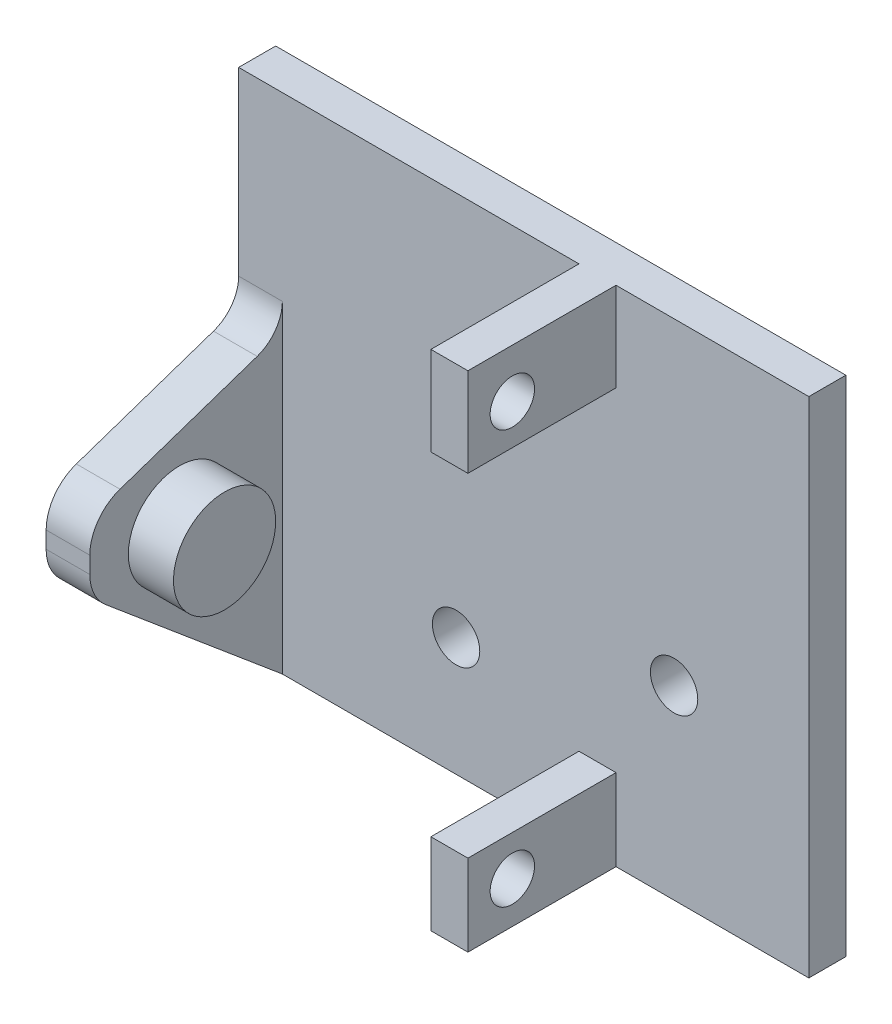
from build123d import *

# Parameters (mm, degrees)
ESBO_O1_W                = 38.5
ESBO_O1_H                = 34
RESSALTO_EXTRUS_O1_DEPTH = 2.5
ESBO_O2_W                = 2.5
ESBO_O2_H                = 6
ESBO_O2_H_2              = 5.5
RESSALTO_EXTRUS_O2_DEPTH = 10
CORTE_EXTRUS_O1_REACH    = 41.373
ESBO_O3_R                = 1.5
ESBO_O4_W                = 2.95
ESBO_O4_H                = 20
RESSALTO_EXTRUS_O3_DEPTH = 13
ESBO_O5_R                = 3.45
CORTE_EXTRUS_O2_DEPTH    = 15
FILETE1_R                = 3
FILETE2_R                = 2.5
ESBO_O7_R                = 3.45
RESSALTO_EXTRUS_O5_DEPTH = 6
ESBO_O8_R                = 1.6
CORTE_EXTRUS_O3_DEPTH    = 6


with BuildPart() as part:
    # Esboço1 → Ressalto-extrusão1 (new body)
    with BuildSketch(Plane.XY):
        with Locations((-3.395014232, -10.289862205)):
            Rectangle(ESBO_O1_W, ESBO_O1_H)
    extrude(amount=RESSALTO_EXTRUS_O1_DEPTH)

    # Esboço2 → Ressalto-extrusão2 (add)
    with BuildSketch(Plane.XY.offset(2.5)):
        with Locations((1.584985768, 3.710137795)):
            Rectangle(ESBO_O2_W, ESBO_O2_H)
        with Locations((1.584985768, -24.539862205)):
            Rectangle(ESBO_O2_W, ESBO_O2_H_2)
    extrude(amount=RESSALTO_EXTRUS_O2_DEPTH)

    # Esboço3 → Corte-extrusão1 (cut, up to next)
    with BuildSketch(Plane(origin=(2.834985768, 0, 0), x_dir=(0, 0, -1), z_dir=(1, 0, 0)), mode=Mode.PRIVATE) as corte_extrus_o1_sk1:
        with Locations(Location((-9.5, 3.410137795, 0), (0, 0, 90))):
            Circle(ESBO_O3_R)
    corte_extrus_o1_tool1 = extrude(corte_extrus_o1_sk1.sketch, amount=-CORTE_EXTRUS_O1_REACH, mode=Mode.PRIVATE) & part.part
    # Esboço3 → Corte-extrusão1 (cut, up to next)
    with BuildSketch(Plane(origin=(2.834985768, 0, 0), x_dir=(0, 0, -1), z_dir=(1, 0, 0)), mode=Mode.PRIVATE) as corte_extrus_o1_sk2:
        with Locations(Location((-9.5, -24.489862205, 0), (0, 0, 90))):
            Circle(ESBO_O3_R)
    corte_extrus_o1_tool2 = extrude(corte_extrus_o1_sk2.sketch, amount=-CORTE_EXTRUS_O1_REACH, mode=Mode.PRIVATE) & part.part
    add(corte_extrus_o1_tool1.solids().sort_by_distance((2.834986, 3.410138, 9.5))[0], mode=Mode.SUBTRACT)
    add(corte_extrus_o1_tool2.solids().sort_by_distance((2.834986, -24.489862, 9.5))[0], mode=Mode.SUBTRACT)

    # Esboço4 → Ressalto-extrusão3 (add)
    with BuildSketch(Plane.XY.offset(2.5)):
        with Locations((-21.170014232, -17.289862205)):
            Rectangle(ESBO_O4_W, ESBO_O4_H)
    extrude(amount=RESSALTO_EXTRUS_O3_DEPTH)

    # Esboço5 → Corte-extrusão2 (cut)
    with BuildSketch(Plane.ZY.offset(22.645014232)):
        Polygon((2.5, -7.289862205), (15.222036194, -11.595443281), (15.5, -11.689515935), (15.5, -7.289862205), align=None)
        Polygon((15.222036194, -16.59994967), (2.5, -27.289862205), (15.5, -27.289862205), (15.5, -16.36638574), align=None)
        with Locations(Location((9.45, -15.089862205, 0), (0, 0, 270))):
            Circle(ESBO_O5_R)
    extrude(amount=-CORTE_EXTRUS_O2_DEPTH, mode=Mode.SUBTRACT)

    # Filete1
    filete1_edges = [part.edges().sort_by_distance(p)[0] for p in [
        (-21.170014232, -11.689515935, 15.5),
        (-21.170014232, -16.36638574, 15.5),
    ]]
    fillet(filete1_edges, radius=FILETE1_R)

    # Filete2
    # the kernel refuses this fillet: 2.5 mm, written as the material it adds along each edge
    with BuildSketch(Plane(origin=(-19.695014232, -7.289862205, 2.5), x_dir=(0, -0.32057353707536407, 0.947223631106715), z_dir=(-1, 0, 0))) as filete2_piece_1:
        with BuildLine():
            CenterArc((FILETE2_R * 0.717282002488, FILETE2_R), FILETE2_R, 198.697613514, 71.302386486)
            Line((-FILETE2_R * 0.229941628618, FILETE2_R * 0.679426462925), (0, 0))
            Line((0, 0), (FILETE2_R * 0.717282002488, 0))
        make_face()
    extrude(amount=2.95)

    # Esboço7 → Ressalto-extrusão5 (add)
    with BuildSketch(Plane.ZY.offset(22.645014232)):
        with Locations(Location((9.45, -15.089862205, 0), (0, 0, 270))):
            Circle(ESBO_O7_R)
    extrude(amount=-RESSALTO_EXTRUS_O5_DEPTH)

    # Esboço8 → Corte-extrusão3 (cut)
    with BuildSketch(Plane(origin=(0, 0, 0), x_dir=(-1, 0, 0), z_dir=(0, 0, -1))):
        with Locations((7.965014232, -19.289862205)):
            Circle(ESBO_O8_R)
        with Locations((-6.754985768, -14.739862205)):
            Circle(ESBO_O8_R)
    extrude(amount=-CORTE_EXTRUS_O3_DEPTH, mode=Mode.SUBTRACT)


solid = part.part
